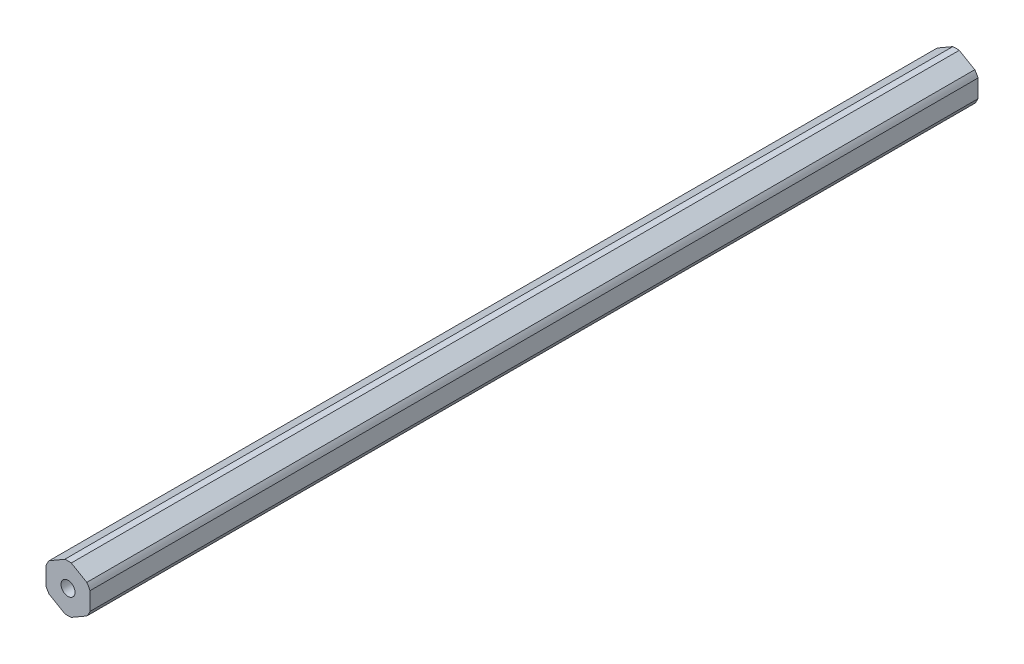
from build123d import *

# Parameters (mm, degrees)
BOSS_EXTRUDE1_DEPTH                  = 128.0795
F_10_32_TAPPED_HOLE1_D               = 4.0386
F_10_32_TAPPED_HOLE1_DEPTH           = 11.938
F_10_32_TAPPED_HOLE1_TIP             = 1.213317848
F_10_32_TAPPED_HOLE1_ON_FACE_2_D     = 4.0386
F_10_32_TAPPED_HOLE1_ON_FACE_2_DEPTH = 11.938
F_10_32_TAPPED_HOLE1_ON_FACE_2_TIP   = 1.213317848


with BuildPart() as part:
    # Sketch1 → Boss-Extrude1 (new, symmetric)
    with BuildSketch(Plane.XY):
        with BuildLine():
            ThreePointArc((0.93173274, 6.79441227), (0, 6.858), (-0.93173274, 6.79441227))
            Line((-0.93173274, 6.79441227), (-5.41826726, 4.204110358))
            ThreePointArc((-5.41826726, 4.204110358), (-5.939202219, 3.429), (-6.35, 2.590301913))
            Line((-6.35, 2.590301913), (-6.35, -2.590301913))
            ThreePointArc((-6.35, -2.590301913), (-5.939202219, -3.429), (-5.41826726, -4.204110358))
            Line((-5.41826726, -4.204110358), (-0.93173274, -6.79441227))
            ThreePointArc((-0.93173274, -6.79441227), (0, -6.858), (0.93173274, -6.79441227))
            Line((0.93173274, -6.79441227), (5.41826726, -4.204110358))
            ThreePointArc((5.41826726, -4.204110358), (5.939202219, -3.429), (6.35, -2.590301913))
            Line((6.35, -2.590301913), (6.35, 2.590301913))
            ThreePointArc((6.35, 2.590301913), (5.939202219, 3.429), (5.41826726, 4.204110358))
            Line((5.41826726, 4.204110358), (0.93173274, 6.79441227))
        make_face()
    extrude(amount=BOSS_EXTRUDE1_DEPTH, both=True)

    # #10-32 Tapped Hole1
    with Locations(Plane.XY.offset(128.0795)):
        with Locations((0, 0)):
            Hole(F_10_32_TAPPED_HOLE1_D / 2, depth=F_10_32_TAPPED_HOLE1_DEPTH)
            with Locations((0, 0, -(F_10_32_TAPPED_HOLE1_DEPTH + F_10_32_TAPPED_HOLE1_TIP / 2))):  # 118° drill point
                Cone(0, F_10_32_TAPPED_HOLE1_D / 2, F_10_32_TAPPED_HOLE1_TIP, mode=Mode.SUBTRACT)

    # #10-32 Tapped Hole1 on face 2
    with Locations(Plane(origin=(0, 0, -128.0795), x_dir=(-1, 0, 0), z_dir=(0, 0, -1))):
        with Locations((0, 0)):
            Hole(F_10_32_TAPPED_HOLE1_ON_FACE_2_D / 2, depth=F_10_32_TAPPED_HOLE1_ON_FACE_2_DEPTH)
            with Locations((0, 0, -(F_10_32_TAPPED_HOLE1_ON_FACE_2_DEPTH + F_10_32_TAPPED_HOLE1_ON_FACE_2_TIP / 2))):  # 118° drill point
                Cone(0, F_10_32_TAPPED_HOLE1_ON_FACE_2_D / 2, F_10_32_TAPPED_HOLE1_ON_FACE_2_TIP, mode=Mode.SUBTRACT)


solid = part.part
